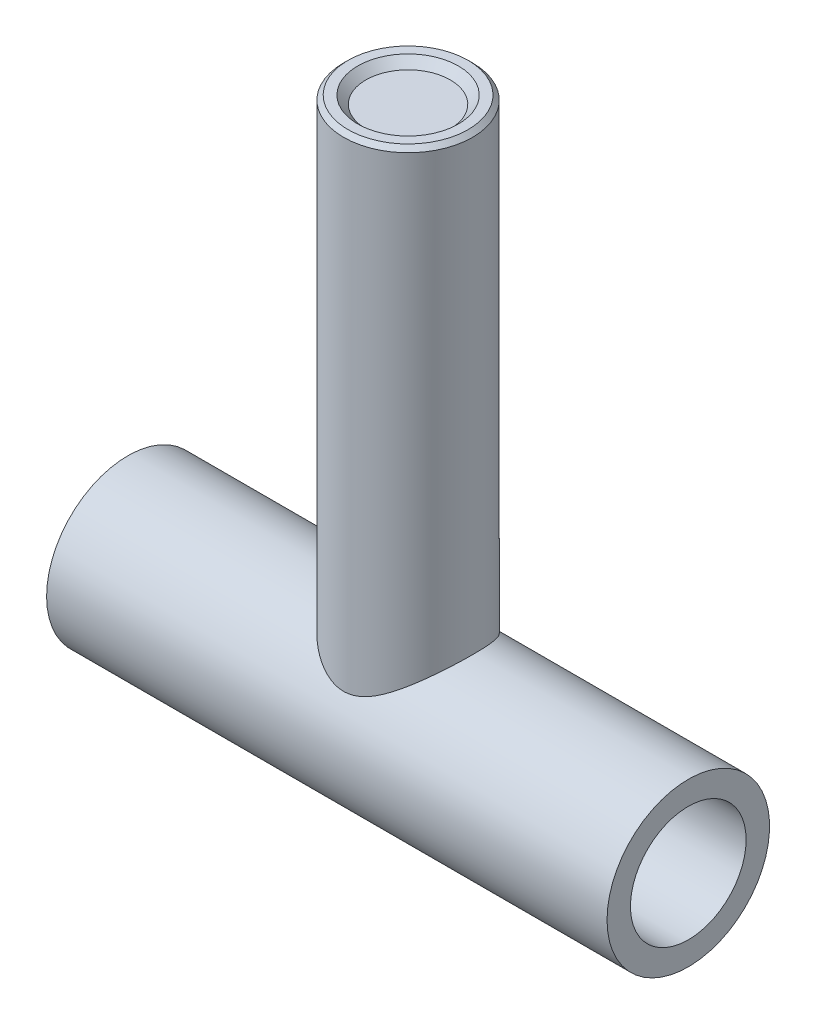
from build123d import *

# Parameters (mm, degrees)
SKETCH1_W             = 126
SKETCH1_H             = 18.27
M22_CLEARANCE_HOLE1_D = 26
BOSS_EXTRUDE1_REACH   = 155.04
SKETCH4_R             = 14.5
CUT_EXTRUDE1_REACH    = 122.851
SKETCH5_R             = 13
SKETCH6_R             = 9.097381441
CUT_EXTRUDE2_DEPTH    = 0.4
CUT_EXTRUDE2_DRAFT    = -70
SKETCH7_R             = 7.998390473
CUT_EXTRUDE3_DEPTH    = 1.26
CUT_EXTRUDE3_DRAFT    = 50
SKETCH8_R             = 9.5
CUT_EXTRUDE4_DEPTH    = 30.5245
SKETCH9_R             = 11.3155
CUT_EXTRUDE5_DEPTH    = 1.8155
CUT_EXTRUDE5_DRAFT    = -45
CHAMFER1_SIZE         = 1
FILLET1_R             = 3.2


with BuildPart() as part:
    # Sketch1 → Revolve1 (revolve)
    with BuildSketch(Plane(origin=(0, 0, 0), x_dir=(-1, 0, 0), z_dir=(0, 0, -1))):
        with Locations((0, 9.135)):
            Rectangle(SKETCH1_W, SKETCH1_H)
    revolve(axis=Axis((63, 0, 0), (-1, 0, 0)))

    # M22 Clearance Hole1 (through all)
    with Locations(Plane(origin=(63, 0, 0), x_dir=(0, 0, -1), z_dir=(1, 0, 0))):
        with Locations((0, 0)):
            Hole(M22_CLEARANCE_HOLE1_D / 2)

    # Sketch4 → Boss-Extrude1 (add, up to next)
    with BuildSketch(Plane(origin=(0, 120, 0), x_dir=(1, 0, 0), z_dir=(0, 1, 0)), mode=Mode.PRIVATE) as boss_extrude1_sk1:
        Circle(SKETCH4_R)
    boss_extrude1_tool1 = extrude(boss_extrude1_sk1.sketch, amount=-BOSS_EXTRUDE1_REACH, mode=Mode.PRIVATE) - part.part
    add(boss_extrude1_tool1.solids().sort_by_distance((0, 120, 0))[0])

    # Sketch5 → Cut-Extrude1 (cut, up to next)
    with BuildSketch(Plane(origin=(0, 18.5, 0), x_dir=(1, 0, 0), z_dir=(0, 1, 0)), mode=Mode.PRIVATE) as cut_extrude1_sk1:
        Circle(SKETCH5_R)
    cut_extrude1_tool1 = extrude(cut_extrude1_sk1.sketch, amount=-CUT_EXTRUDE1_REACH, mode=Mode.PRIVATE) & part.part
    add(cut_extrude1_tool1.solids().sort_by_distance((0, 18.5, 0))[0], mode=Mode.SUBTRACT)


with BuildPart() as cut_extrude2_tool:
    # Sketch6 → Cut-Extrude2 (with draft: the straight prism first)
    with BuildSketch(Plane.XZ.offset(-18.5)):
        Circle(SKETCH6_R)
    extrude(amount=-CUT_EXTRUDE2_DEPTH)
    # Cut-Extrude2: the draft: its side faces are tilted about the plane it starts from
    cut_extrude2_sides = [cut_extrude2_tool.faces().sort_by_distance(p)[0] for p in [
        (-9.097381441, 18.7, 0),
    ]]
    draft(cut_extrude2_sides, Plane.XZ.offset(-18.5), CUT_EXTRUDE2_DRAFT)


with BuildPart() as part_1:
    add(part.part)

    # Cut-Extrude2: cut by cut_extrude2_tool
    add(cut_extrude2_tool.part, mode=Mode.SUBTRACT)


with BuildPart() as cut_extrude3_tool:
    # Sketch7 → Cut-Extrude3 (with draft: the straight prism first)
    with BuildSketch(Plane.XZ.offset(-18.9)):
        Circle(SKETCH7_R)
    extrude(amount=-CUT_EXTRUDE3_DEPTH)
    # Cut-Extrude3: the draft: its side faces are tilted about the plane it starts from
    cut_extrude3_sides = [cut_extrude3_tool.faces().sort_by_distance(p)[0] for p in [
        (-7.998390473, 19.53, 0),
    ]]
    draft(cut_extrude3_sides, Plane.XZ.offset(-18.9), CUT_EXTRUDE3_DRAFT)


with BuildPart() as part_2:
    add(part_1.part)

    # Cut-Extrude3: cut by cut_extrude3_tool
    add(cut_extrude3_tool.part, mode=Mode.SUBTRACT)

    # Sketch8 → Cut-Extrude4 (cut)
    with BuildSketch(Plane.XZ.offset(-20.16)):
        Circle(SKETCH8_R)
    extrude(amount=-CUT_EXTRUDE4_DEPTH, mode=Mode.SUBTRACT)


with BuildPart() as cut_extrude5_tool:
    # Sketch9 → Cut-Extrude5 (with draft: the straight prism first)
    with BuildSketch(Plane(origin=(0, 120, 0), x_dir=(-1, 0, 0), z_dir=(0, 1, 0))):
        Circle(SKETCH9_R)
    extrude(amount=-CUT_EXTRUDE5_DEPTH)
    # Cut-Extrude5: the draft: its side faces are tilted about the plane it starts from
    cut_extrude5_sides = [cut_extrude5_tool.faces().sort_by_distance(p)[0] for p in [
        (11.3155, 119.09225, 0),
    ]]
    draft(cut_extrude5_sides, Plane(origin=(0, 120, 0), x_dir=(-1, 0, 0), z_dir=(0, 1, 0)), CUT_EXTRUDE5_DRAFT)


with BuildPart() as part_3:
    add(part_2.part)

    # Cut-Extrude5: cut by cut_extrude5_tool
    add(cut_extrude5_tool.part, mode=Mode.SUBTRACT)

    # Chamfer1
    chamfer1_edges = [part_3.edges().sort_by_distance(p)[0] for p in [
        (-14.5, 120, 0),
    ]]
    chamfer(chamfer1_edges, length=CHAMFER1_SIZE)

    # Fillet1
    fillet1_edges = [part_3.edges().sort_by_distance(p)[0] for p in [
        (-13, 18.5, 0),
    ]]
    fillet(fillet1_edges, radius=FILLET1_R)


solid = part_3.part
